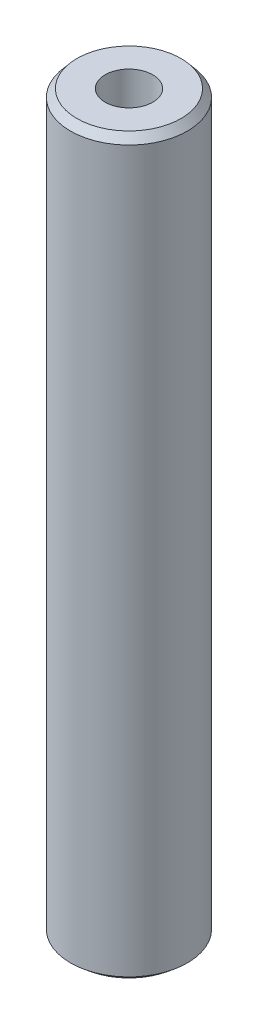
from build123d import *
from OCP.BRepFilletAPI import BRepFilletAPI_MakeChamfer

# Parameters (mm, degrees)
SKETCH1_R           = 45
BOSS_EXTRUDE1_DEPTH = 565.540317169
SKETCH2_R           = 18.329955525
CUT_EXTRUDE1_DEPTH  = 570.109699745
CHAMFER1_SIZE       = 5.914260321
CHAMFER1_SIZE2      = 4.923435275


with BuildPart() as part:
    # Sketch1 → Boss-Extrude1 (new body)
    with BuildSketch(Plane(origin=(0, 0, 0), x_dir=(1, 0, 0), z_dir=(0, 1, 0))):
        Circle(SKETCH1_R)
    extrude(amount=BOSS_EXTRUDE1_DEPTH)

    # Sketch2 → Cut-Extrude1 (cut, through all)
    with BuildSketch(Plane(origin=(0, 0, 0), x_dir=(1, 0, 0), z_dir=(0, 1, 0))):
        Circle(SKETCH2_R)
    extrude(amount=CUT_EXTRUDE1_DEPTH, mode=Mode.SUBTRACT)

    # Chamfer1: one chamfer whose edges measure the first distance from different faces: ONE call of the kernel's chamfer builder (chamfer() names one face for all edges)
    chamfer1_edges_1 = [part.edges().sort_by_distance(p)[0] for p in [
        (-45, 565.540317169, 0),
    ]]
    chamfer1_side_1 = [part.faces().sort_by_distance(p)[0] for p in [
        (-45, 282.770158585, 0),
    ]]
    chamfer1_edges_2 = [part.edges().sort_by_distance(p)[0] for p in [
        (-45, 0, 0),
    ]]
    chamfer1_side_2 = [part.faces().sort_by_distance(p)[0] for p in [
        (-43.727207794, 0, 0),
    ]]
    chamfer1 = BRepFilletAPI_MakeChamfer(part.part.solid().wrapped)
    for e in chamfer1_edges_1:
        chamfer1.Add(CHAMFER1_SIZE, CHAMFER1_SIZE2, e.wrapped, chamfer1_side_1[0].wrapped)  # the first distance lies on this face
    for e in chamfer1_edges_2:
        chamfer1.Add(CHAMFER1_SIZE, CHAMFER1_SIZE2, e.wrapped, chamfer1_side_2[0].wrapped)  # the first distance lies on this face
    add(Compound.cast(chamfer1.Shape()), mode=Mode.REPLACE)


solid = part.part
